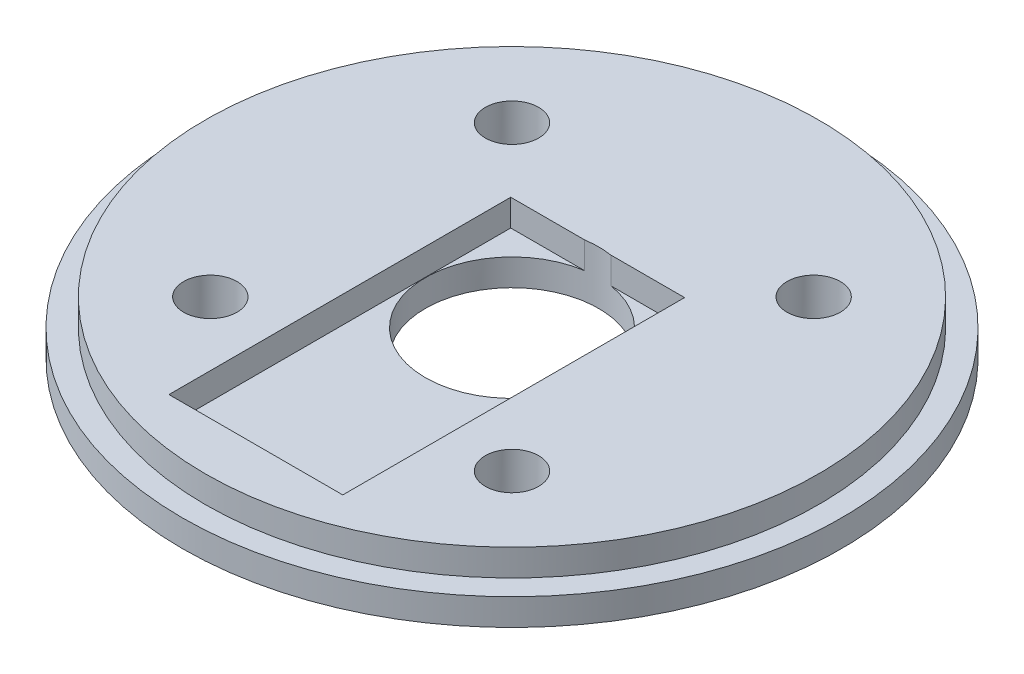
from build123d import *

# Parameters (mm, degrees)
SKETCH2_R                       = 39.243
BOSS_EXTRUDE1_DEPTH             = 6.35
CUT_EXTRUDE1_START              = -3.175
SKETCH4_R                       = 39.243
SKETCH4_R_2                     = 36.5125
CUT_EXTRUDE1_DEPTH              = 3.175
F_1_4_0_25_DIAMETER_HOLE1_D     = 6.35
F_13_16_0_8125_DIAMETER_HOLE1_D = 20.6375
SKETCH9_R                       = 6.35
CUT_EXTRUDE2_DEPTH              = 1.5875
SKETCH11_W                      = 20.7
SKETCH11_H                      = 40.7
CUT_EXTRUDE3_DEPTH              = 3.175


with BuildPart() as part:
    # Sketch2 → Boss-Extrude1 (new body)
    with BuildSketch(Plane(origin=(0, 0, 0), x_dir=(1, 0, 0), z_dir=(0, 1, 0))):
        Circle(SKETCH2_R)
    extrude(amount=BOSS_EXTRUDE1_DEPTH)

    # Sketch4 → Cut-Extrude1 (cut)
    with BuildSketch(Plane(origin=(0, 6.35, 0), x_dir=(1, 0, 0), z_dir=(0, 1, 0)).offset(CUT_EXTRUDE1_START)):
        Circle(SKETCH4_R)
        Circle(SKETCH4_R_2, mode=Mode.SUBTRACT)
    extrude(amount=CUT_EXTRUDE1_DEPTH, mode=Mode.SUBTRACT)

    # 1/4 (0.25) Diameter Hole1 (through all)
    with Locations(Plane(origin=(0, 6.35, 0), x_dir=(1, 0, 0), z_dir=(0, 1, 0))):
        with Locations((-17.960512242, 17.960512242), (-17.960512242, -17.960512242), (17.960512242, 17.960512242), (17.960512242, -17.960512242)):
            Hole(F_1_4_0_25_DIAMETER_HOLE1_D / 2)

    # 13/16 (0.8125) Diameter Hole1 (through all)
    with Locations(Plane(origin=(0, 6.35, 0), x_dir=(1, 0, 0), z_dir=(0, 1, 0))):
        with Locations((0, 0)):
            Hole(F_13_16_0_8125_DIAMETER_HOLE1_D / 2)

    # Sketch9 → Cut-Extrude2 (cut)
    with BuildSketch(Plane.XZ):
        with Locations((-17.960512242, 17.960512242)):
            Circle(SKETCH9_R)
        with Locations((17.960512242, 17.960512242)):
            Circle(SKETCH9_R)
        with Locations((17.960512242, -17.960512242)):
            Circle(SKETCH9_R)
        with Locations((-17.960512242, -17.960512242)):
            Circle(SKETCH9_R)
    extrude(amount=-CUT_EXTRUDE2_DEPTH, mode=Mode.SUBTRACT)

    # Sketch11 → Cut-Extrude3 (cut)
    with BuildSketch(Plane(origin=(0, 6.35, 0), x_dir=(1, 0, 0), z_dir=(0, 1, 0))):
        with Locations((0, -10.15)):
            Rectangle(SKETCH11_W, SKETCH11_H)
    extrude(amount=-CUT_EXTRUDE3_DEPTH, mode=Mode.SUBTRACT)


solid = part.part
